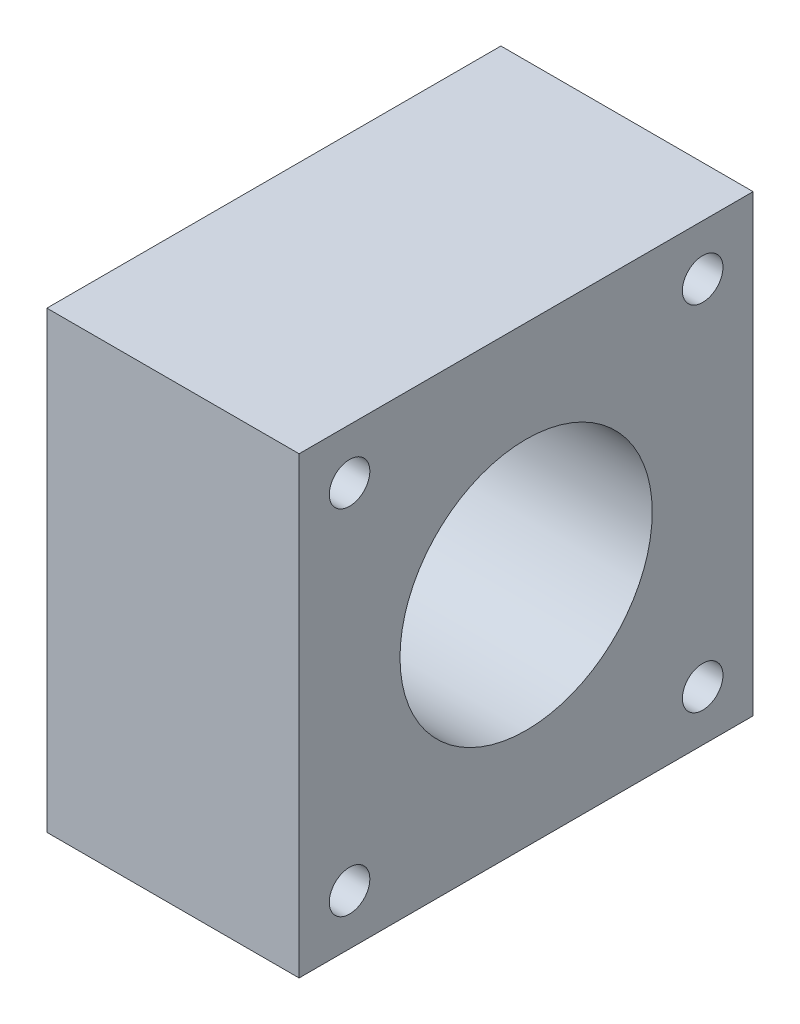
from build123d import *

# Parameters (mm, degrees)
SKETCH2_W               = 57.15
SKETCH2_H               = 57.15
BOSS_EXTRUDE2_DEPTH     = 31.75
SKETCH3_R               = 15.875
CUT_EXTRUDE1_DEPTH      = 87.834944003
CUT_EXTRUDE2_DEPTH      = 2.54
FILLET1_R               = 3.175
F_1_4_20_TAPPED_HOLE1_D = 5.1054


with BuildPart() as part:
    # Sketch2 → Boss-Extrude2 (new body)
    with BuildSketch(Plane(origin=(0, 0, 0), x_dir=(0, 0, -1), z_dir=(1, 0, 0))):
        with Locations((28.575, 28.575)):
            Rectangle(SKETCH2_W, SKETCH2_H)
    extrude(amount=BOSS_EXTRUDE2_DEPTH)

    # Sketch3 → Cut-Extrude1 (cut, through all)
    with BuildSketch(Plane(origin=(31.75, 0, 0), x_dir=(0, 0, -1), z_dir=(1, 0, 0))):
        with Locations((28.575, 28.575)):
            Circle(SKETCH3_R)
    extrude(amount=-CUT_EXTRUDE1_DEPTH, mode=Mode.SUBTRACT)

    # Sketch4 → Cut-Extrude2 (cut)
    with BuildSketch(Plane.ZY):
        with BuildLine():
            Line((-36.188382543, 46.0375), (-20.961617457, 46.0375))
            ThreePointArc((-20.961617457, 46.0375), (-9.525, 28.575), (-20.961617457, 11.1125))
            Line((-20.961617457, 11.1125), (-36.188382543, 11.1125))
            ThreePointArc((-36.188382543, 11.1125), (-47.625, 28.575), (-36.188382543, 46.0375))
        make_face()
    extrude(amount=-CUT_EXTRUDE2_DEPTH, mode=Mode.SUBTRACT)

    # Fillet1
    fillet1_edges = [part.edges().sort_by_distance(p)[0] for p in [
        (1.27, 11.1125, -36.188382543),
        (1.27, 11.1125, -20.961617457),
        (1.27, 46.0375, -20.961617457),
        (1.27, 46.0375, -36.188382543),
    ]]
    fillet(fillet1_edges, radius=FILLET1_R)

    # 1/4-20 Tapped Hole1 (through all)
    with Locations(Plane(origin=(31.75, 0, 0), x_dir=(0, 0, -1), z_dir=(1, 0, 0))):
        with Locations((6.35, 50.8), (50.8, 50.8), (50.8, 6.35), (6.35, 6.35), (28.575, 28.575)):
            Hole(F_1_4_20_TAPPED_HOLE1_D / 2)


solid = part.part
